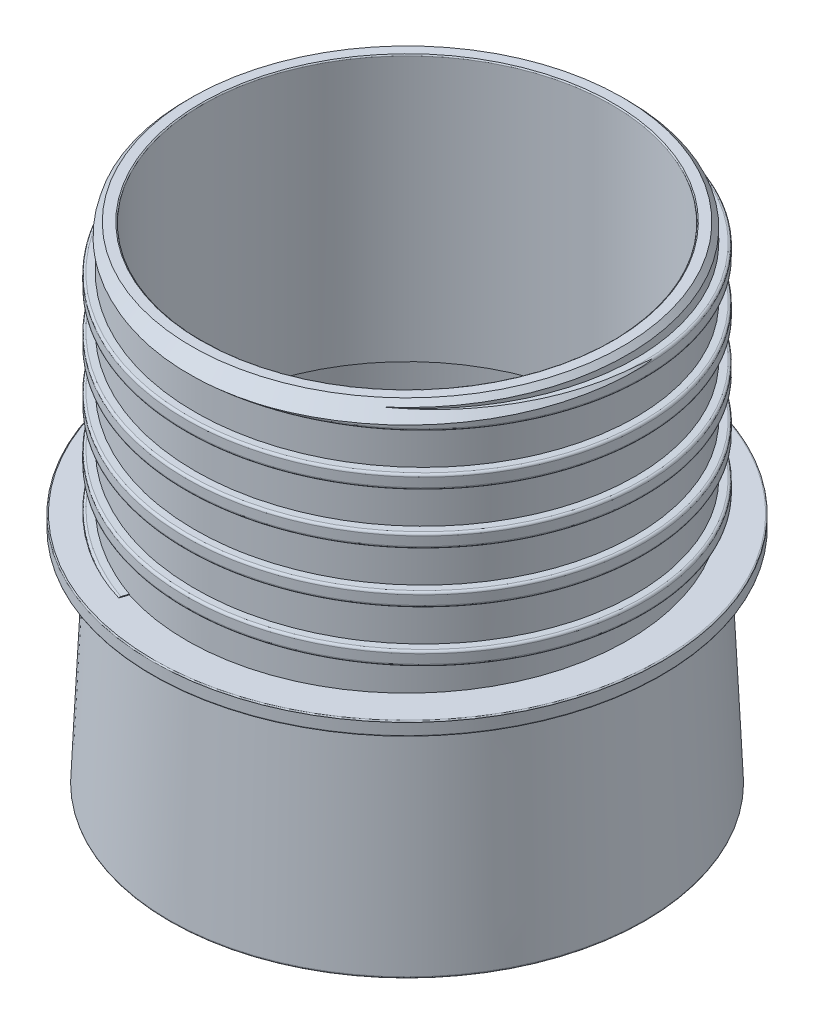
from build123d import *

# Parameters (mm, degrees)
SWEEP1_PITCH = 11.45
FILLET1_R    = 0.25
FILLET2_R    = 0.4


with BuildPart() as part:
    # Sketch1 → Revolve1 (revolve)
    with BuildSketch(Plane.XY, mode=Mode.PRIVATE) as revolve1_sk:
        Polygon((49.5, 59.7), (46, 59.7), (46, 0), (48.1, 0), (50.35, -49.75), (53.45, -49.75), (51.2, 0), (57.2, 0), (57.2, 3.05), (49.5, 3.05), align=None)
    revolve(revolve1_sk.sketch.rotate(Axis((0, 0, 0), (0, 1, 0)), 90), axis=Axis((0, 0, 0), (0, 1, 0)))

    # Sweep1: the profile of Sketch4 profile screwed along a left-hand helix of 5.2 turns, 16 arcs to a turn; built about Z, then put on its axis
    sweep1_z = Axis((0, 0, 0), (0, 0, 1))
    sweep1_corners = [(49.4997, 0, 0), (51, 0, 0), (51.5, 0, -0.5), (51.5, 0, -2.55), (51, 0, -3.05), (49.4997, 0, -3.05)]
    with BuildLine(mode=Mode.PRIVATE) as sweep1_profile:
        Line(sweep1_corners[0], sweep1_corners[1])
        Line(sweep1_corners[2], sweep1_corners[3])
        Line(sweep1_corners[4], sweep1_corners[5])
        Line(sweep1_corners[5], sweep1_corners[0])
        ThreePointArc((51, 0, 0), (51.353553391, 0, -0.146446609), (51.5, 0, -0.5))
        ThreePointArc((51.5, 0, -2.55), (51.353553391, 0, -2.903553391), (51, 0, -3.05))
    sweep1_cap = Face(sweep1_profile.wire())
    sweep1_arcs = [((51, 0, 0), (51.5, 0, 0), (51.5, 0, -0.5), (1, 0.7071067811865375, 1)), ((51.5, 0, -2.55), (51.5, 0, -3.05), (51, 0, -3.05), (1, 0.7071067811865375, 1))]  # start, shoulder, end, weights
    sweep1_turn_angles = [0, -11.25, -22.5, -33.75, -45, -56.25, -67.5, -78.75, -90, -101.25, -112.5, -123.75, -135, -146.25, -157.5, -168.75, -180, -191.25, -202.5, -213.75, -225, -236.25, -247.5, -258.75, -270, -281.25, -292.5, -303.75, -315, -326.25, -337.5, -348.75, -360]
    sweep1_turn_weights = [1, 0.9807852804032304, 1, 0.9807852804032304, 1, 0.9807852804032304, 1, 0.9807852804032304, 1, 0.9807852804032304, 1, 0.9807852804032304, 1, 0.9807852804032304, 1, 0.9807852804032304, 1, 0.9807852804032304, 1, 0.9807852804032304, 1, 0.9807852804032304, 1, 0.9807852804032304, 1, 0.9807852804032304, 1, 0.9807852804032304, 1, 0.9807852804032304, 1, 0.9807852804032304, 1]
    sweep1_turn_rails = [Edge.make_bspline([Vector(p[0], p[1], 0).rotate(sweep1_z, sweep1_turn_angles[k]) / sweep1_turn_weights[k] + Vector(0, 0, p[2] + -SWEEP1_PITCH * sweep1_turn_angles[k] / 360) for k in range(33)], [0, 0, 0, 1, 1, 2, 2, 3, 3, 4, 4, 5, 5, 6, 6, 7, 7, 8, 8, 9, 9, 10, 10, 11, 11, 12, 12, 13, 13, 14, 14, 15, 15, 16, 16, 16], 2, sweep1_turn_weights) for p in sweep1_corners]
    sweep1_turn_sides = [*[Face.make_surface_from_curves(sweep1_turn_rails[p[0]], sweep1_turn_rails[p[1]]) for p in [(0, 1), (2, 3), (4, 5), (5, 0)]], *[Face.make_bezier_surface([[Vector(p[j][0], p[j][1], 0).rotate(sweep1_z, sweep1_turn_angles[2 * i + k]) / sweep1_turn_weights[2 * i + k] + Vector(0, 0, p[j][2] + -SWEEP1_PITCH * sweep1_turn_angles[2 * i + k] / 360) for k in range(3)] for j in range(3)], [[p[3][j] * sweep1_turn_weights[2 * i + k] for k in range(3)] for j in range(3)]) for p in sweep1_arcs for i in range(16)]]
    sweep1_last_angles = [-1800, -1811.25, -1822.5, -1833.75, -1845, -1856.25, -1867.5, -1869.75, -1872]
    sweep1_last_weights = [1, 0.9807852804032304, 1, 0.9807852804032304, 1, 0.9807852804032304, 1, 0.9992290362407248, 1]
    sweep1_last_rails = [Edge.make_bspline([Vector(p[0], p[1], 0).rotate(sweep1_z, sweep1_last_angles[k]) / sweep1_last_weights[k] + Vector(0, 0, p[2] + -SWEEP1_PITCH * sweep1_last_angles[k] / 360) for k in range(9)], [0, 0, 0, 1, 1, 2, 2, 3, 3, 4, 4, 4], 2, sweep1_last_weights) for p in sweep1_corners]
    sweep1_last_sides = [*[Face.make_surface_from_curves(sweep1_last_rails[p[0]], sweep1_last_rails[p[1]]) for p in [(0, 1), (2, 3), (4, 5), (5, 0)]], *[Face.make_bezier_surface([[Vector(p[j][0], p[j][1], 0).rotate(sweep1_z, sweep1_last_angles[2 * i + k]) / sweep1_last_weights[2 * i + k] + Vector(0, 0, p[j][2] + -SWEEP1_PITCH * sweep1_last_angles[2 * i + k] / 360) for k in range(3)] for j in range(3)], [[p[3][j] * sweep1_last_weights[2 * i + k] for k in range(3)] for j in range(3)]) for p in sweep1_arcs for i in range(4)]]
    sweep1 = Plane(origin=(0, 59.7, 0), x_dir=(-1, 0, 0), z_dir=(0, -1, 0)) * Solid(Shell([*[p.moved(Location((0, 0, SWEEP1_PITCH * i))) for i in range(5) for p in sweep1_turn_sides], *sweep1_last_sides, sweep1_cap, sweep1_cap.rotate(sweep1_z, -1872).moved(Location((0, 0, -SWEEP1_PITCH * -1872 / 360)))]))
    add(sweep1)

    # Sketch5 → Cut-Revolve1 (revolve, cut)
    with BuildSketch(Plane.XY, mode=Mode.PRIVATE) as cut_revolve1_sk:
        Polygon((48.4, 59.7), (53.4, 54.7), (58.4, 54.7), (58.4, 64.7), (48.4, 64.7), align=None)
    revolve(cut_revolve1_sk.sketch.rotate(Axis((0, 0, 0), (0, 1, 0)), 90), axis=Axis((0, 0, 0), (0, 1, 0)), mode=Mode.SUBTRACT)

    # Fillet1
    fillet1_edges = [part.edges().sort_by_distance(p)[0] for p in [
        (0, 59.7, 46),
        (0, 3.05, 57.2),
        (0, 0, 57.2),
    ]]
    fillet(fillet1_edges, radius=FILLET1_R)

    # Fillet2
    fillet2_edges = [part.edges().sort_by_distance(p)[0] for p in [
        (0, -49.75, 53.45),
        (0, -49.75, 50.35),
    ]]
    fillet(fillet2_edges, radius=FILLET2_R)


solid = part.part
